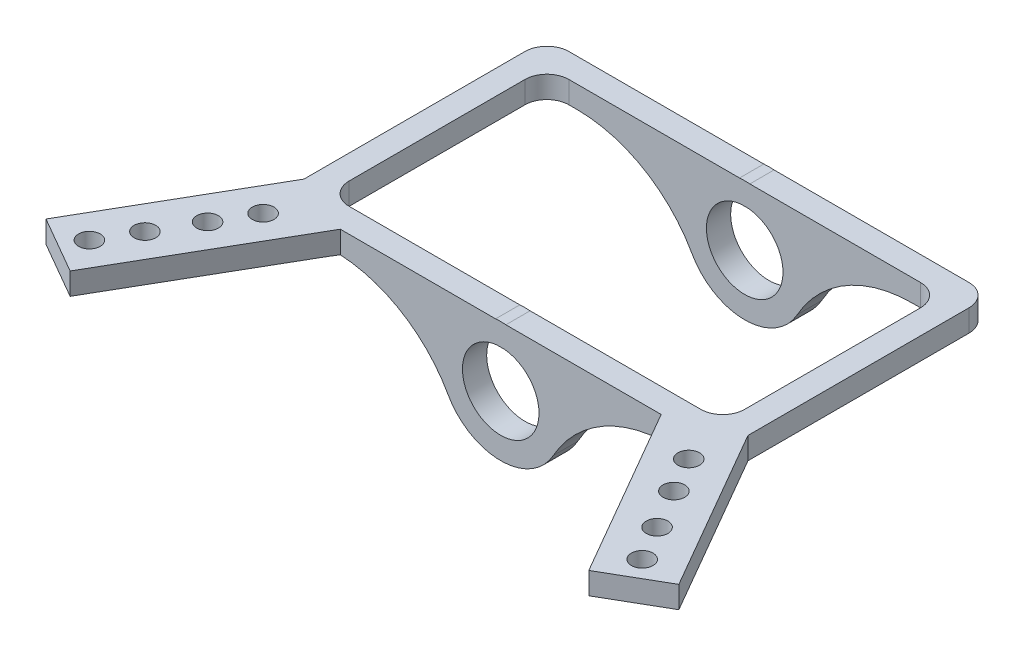
from build123d import *

# Parameters (mm, degrees)
SKETCH2_W               = 114.3
SKETCH2_H               = 63.5
BOSS_EXTRUDE1_DEPTH     = 6.35
CUT_EXTRUDE1_REACH      = 114.674
SKETCH3_R               = 3.125
BOSS_EXTRUDE7_REACH     = 158.854
SKETCH5_R               = 17.4135
SKETCH5_R_2             = 11.0635
FILLET1_R               = 38.1
CUT_EXTRUDE2_DEPTH      = 118.744132595
CUT_EXTRUDE2_DEPTH_BACK = 118.744132595
SKETCH6_W               = 114.3
SKETCH6_H               = 63.5
FILLET2_R               = 6.35


with BuildPart() as part:
    # Sketch2 → Boss-Extrude1 (new body)
    with BuildSketch(Plane(origin=(0, 0, 0), x_dir=(1, 0, 0), z_dir=(0, 1, 0))):
        Polygon((-64.561316825, 62.034331754), (-64.561316825, -8.177280248), (-91.845008266, -55.434020042), (-75.347224324, -64.959020042), (-46.772224324, -15.465668216), (45.949590674, -15.465668216), (74.524590674, -64.959020042), (91.022374616, -55.434020042), (63.738683175, -8.177280248), (63.738683175, 62.034331754), align=None)
        with Locations((-0.411316825, 23.284331754)):
            Rectangle(SKETCH2_W, SKETCH2_H, mode=Mode.SUBTRACT)
    extrude(amount=BOSS_EXTRUDE1_DEPTH)

    # Sketch3 → Cut-Extrude1 (cut, up to next)
    with BuildSketch(Plane(origin=(0, 6.35, 0), x_dir=(1, 0, 0), z_dir=(0, 1, 0)), mode=Mode.PRIVATE) as cut_extrude1_sk1:
        with Locations(Location((-67.783616297, -32.808466651, 0), (0, 0, 270))):
            Circle(SKETCH3_R)
    cut_extrude1_tool1 = extrude(cut_extrude1_sk1.sketch, amount=-CUT_EXTRUDE1_REACH, mode=Mode.PRIVATE) & part.part
    # Sketch3 → Cut-Extrude1 (cut, up to next)
    with BuildSketch(Plane(origin=(0, 6.35, 0), x_dir=(1, 0, 0), z_dir=(0, 1, 0)), mode=Mode.PRIVATE) as cut_extrude1_sk2:
        with Locations(Location((-61.908616236, -22.632668051, 0), (0, 0, 270))):
            Circle(SKETCH3_R)
    cut_extrude1_tool2 = extrude(cut_extrude1_sk2.sketch, amount=-CUT_EXTRUDE1_REACH, mode=Mode.PRIVATE) & part.part
    # Sketch3 → Cut-Extrude1 (cut, up to next)
    with BuildSketch(Plane(origin=(0, 6.35, 0), x_dir=(1, 0, 0), z_dir=(0, 1, 0)), mode=Mode.PRIVATE) as cut_extrude1_sk3:
        with Locations(Location((-74.408616255, -44.283303179, 0), (0, 0, 270))):
            Circle(SKETCH3_R)
    cut_extrude1_tool3 = extrude(cut_extrude1_sk3.sketch, amount=-CUT_EXTRUDE1_REACH, mode=Mode.PRIVATE) & part.part
    # Sketch3 → Cut-Extrude1 (cut, up to next)
    with BuildSketch(Plane(origin=(0, 6.35, 0), x_dir=(1, 0, 0), z_dir=(0, 1, 0)), mode=Mode.PRIVATE) as cut_extrude1_sk4:
        with Locations(Location((-80.283616316, -54.459101779, 0), (0, 0, 270))):
            Circle(SKETCH3_R)
    cut_extrude1_tool4 = extrude(cut_extrude1_sk4.sketch, amount=-CUT_EXTRUDE1_REACH, mode=Mode.PRIVATE) & part.part
    # Sketch3 → Cut-Extrude1 (cut, up to next)
    with BuildSketch(Plane(origin=(0, 6.35, 0), x_dir=(1, 0, 0), z_dir=(0, 1, 0)), mode=Mode.PRIVATE) as cut_extrude1_sk5:
        with Locations(Location((79.460982666, -54.459101779, 0), (0, 0, 270))):
            Circle(SKETCH3_R)
    cut_extrude1_tool5 = extrude(cut_extrude1_sk5.sketch, amount=-CUT_EXTRUDE1_REACH, mode=Mode.PRIVATE) & part.part
    # Sketch3 → Cut-Extrude1 (cut, up to next)
    with BuildSketch(Plane(origin=(0, 6.35, 0), x_dir=(1, 0, 0), z_dir=(0, 1, 0)), mode=Mode.PRIVATE) as cut_extrude1_sk6:
        with Locations(Location((73.585982605, -44.283303179, 0), (0, 0, 270))):
            Circle(SKETCH3_R)
    cut_extrude1_tool6 = extrude(cut_extrude1_sk6.sketch, amount=-CUT_EXTRUDE1_REACH, mode=Mode.PRIVATE) & part.part
    # Sketch3 → Cut-Extrude1 (cut, up to next)
    with BuildSketch(Plane(origin=(0, 6.35, 0), x_dir=(1, 0, 0), z_dir=(0, 1, 0)), mode=Mode.PRIVATE) as cut_extrude1_sk7:
        with Locations(Location((61.085982586, -22.632668051, 0), (0, 0, 270))):
            Circle(SKETCH3_R)
    cut_extrude1_tool7 = extrude(cut_extrude1_sk7.sketch, amount=-CUT_EXTRUDE1_REACH, mode=Mode.PRIVATE) & part.part
    # Sketch3 → Cut-Extrude1 (cut, up to next)
    with BuildSketch(Plane(origin=(0, 6.35, 0), x_dir=(1, 0, 0), z_dir=(0, 1, 0)), mode=Mode.PRIVATE) as cut_extrude1_sk8:
        with Locations(Location((66.960982647, -32.808466651, 0), (0, 0, 270))):
            Circle(SKETCH3_R)
    cut_extrude1_tool8 = extrude(cut_extrude1_sk8.sketch, amount=-CUT_EXTRUDE1_REACH, mode=Mode.PRIVATE) & part.part
    add(cut_extrude1_tool1.solids().sort_by_distance((-67.783616, 6.35, 32.808467))[0], mode=Mode.SUBTRACT)
    add(cut_extrude1_tool2.solids().sort_by_distance((-61.908616, 6.35, 22.632668))[0], mode=Mode.SUBTRACT)
    add(cut_extrude1_tool3.solids().sort_by_distance((-74.408616, 6.35, 44.283303))[0], mode=Mode.SUBTRACT)
    add(cut_extrude1_tool4.solids().sort_by_distance((-80.283616, 6.35, 54.459102))[0], mode=Mode.SUBTRACT)
    add(cut_extrude1_tool5.solids().sort_by_distance((79.460983, 6.35, 54.459102))[0], mode=Mode.SUBTRACT)
    add(cut_extrude1_tool6.solids().sort_by_distance((73.585983, 6.35, 44.283303))[0], mode=Mode.SUBTRACT)
    add(cut_extrude1_tool7.solids().sort_by_distance((61.085983, 6.35, 22.632668))[0], mode=Mode.SUBTRACT)
    add(cut_extrude1_tool8.solids().sort_by_distance((66.960983, 6.35, 32.808467))[0], mode=Mode.SUBTRACT)

    # Boss-Extrude7: up to this face of the body (flat: up to its plane)
    boss_extrude7_end = Plane(part.part.faces().sort_by_distance((-0.411316825, 3.175, 15.465668216))[0])
    # Sketch5 → Boss-Extrude7 (add, up to the picked face)
    with BuildSketch(Plane(origin=(0, 0, -62.034331754), x_dir=(-1, 0, 0), z_dir=(0, 0, -1)), mode=Mode.PRIVATE) as boss_extrude7_sk1:
        with Locations(Location((0.411316825, -11, 0), (0, 0, 39.175198934))):
            Circle(SKETCH5_R)
        with Locations(Location((0.411316825, -11, 0), (0, 0, 83.858334426))):
            Circle(SKETCH5_R_2, mode=Mode.SUBTRACT)
    boss_extrude7_tool1 = split(extrude(boss_extrude7_sk1.sketch, amount=-BOSS_EXTRUDE7_REACH, mode=Mode.PRIVATE), bisect_by=boss_extrude7_end, keep=Keep.BOTH, mode=Mode.PRIVATE)
    add(boss_extrude7_tool1.solids().sort_by(Axis((12.706125, -21.688873, -62.034332), (0, 0, 1)))[0])

    # Fillet1
    # the kernel refuses this fillet: 38.1 mm, written as the material it adds along each edge
    with BuildSketch(Plane(origin=(-13.910575406, 0, -62.034331754), x_dir=(-0.0867632885558369, -0.9962289554911443, 0), z_dir=(0, 0, 1))) as fillet1_piece_1:
        with BuildLine():
            CenterArc((40.988707325, -31.512603208), FILLET1_R, 124.197770407, 60.77965812)
            Line((3.032384121, -34.818284502), (0, 0))
            ThreePointArc((0, 0), (9.787278443, -3.010751549), (19.574556886, 0))
        make_face()
    extrude(amount=7)
    with BuildSketch(Plane(origin=(-13.910575406, 0, -62.034331754), x_dir=(-0.0867632885558369, -0.9962289554911443, 0), z_dir=(0, 0, 1))) as fillet1_piece_2_section:
        with BuildLine():
            CenterArc((40.988707325, -31.512603208), FILLET1_R, 124.197770407, 60.77965812)
            Line((3.032384121, -34.818284502), (0, 0))
            ThreePointArc((0, 0), (9.787278443, -3.010751549), (19.574556886, 0))
        make_face()
    fillet1_piece_2 = extrude(amount=94.37520705, mode=Mode.PRIVATE)
    fillet1_piece_2 = split(fillet1_piece_2, bisect_by=Plane(origin=(-46.479711347, 0.329171961, 15.465668216), z_dir=(0, 0, -1)), keep=Keep.TOP, mode=Mode.PRIVATE)
    fillet1_piece_2 = split(fillet1_piece_2, bisect_by=Plane(origin=(-46.479711347, 0.329171961, 8.465668246), z_dir=(0, 0, 1)), keep=Keep.TOP, mode=Mode.PRIVATE)
    fillet1_piece_2 = split(fillet1_piece_2, bisect_by=Plane(origin=(-44.894051642, 0.329171961, 12.212577706), z_dir=(-0.8660254037844385, 0, -0.5000000000000003)), keep=Keep.TOP, mode=Mode.PRIVATE)
    add(fillet1_piece_2)
    with BuildSketch(Plane(origin=(-13.910575406, 0, -62.034331754), x_dir=(-0.0867632885558369, -0.9962289554911443, 0), z_dir=(0, 0, 1))) as fillet1_piece_3_section:
        with BuildLine():
            CenterArc((40.988707325, -31.512603208), FILLET1_R, 124.197770407, 60.77965812)
            Line((3.032384121, -34.818284502), (0, 0))
            ThreePointArc((0, 0), (9.787278443, -3.010751549), (19.574556886, 0))
        make_face()
    fillet1_piece_3 = extrude(amount=94.37520705, mode=Mode.PRIVATE)
    fillet1_piece_3 = split(fillet1_piece_3, bisect_by=Plane(origin=(-48.157624669, 0.376146064, 15.465668216), z_dir=(0, 0, 1)), keep=Keep.TOP, mode=Mode.PRIVATE)
    fillet1_piece_3 = split(fillet1_piece_3, bisect_by=Plane(origin=(-47.638099539, 0.376146064, 16.965408082), z_dir=(-0.8660254037844385, 0, -0.5000000000000003)), keep=Keep.TOP, mode=Mode.PRIVATE)
    add(fillet1_piece_3)
    with BuildSketch(Plane(origin=(-13.910575406, 0, -62.034331754), x_dir=(-0.0867632885558369, -0.9962289554911443, 0), z_dir=(0, 0, 1))) as fillet1_piece_4_section:
        with BuildLine():
            CenterArc((40.988707325, -31.512603208), FILLET1_R, 124.197770407, 60.77965812)
            Line((3.032384121, -34.818284502), (0, 0))
            ThreePointArc((0, 0), (9.787278443, -3.010751549), (19.574556886, 0))
        make_face()
    fillet1_piece_4 = extrude(amount=94.37520705, mode=Mode.PRIVATE)
    fillet1_piece_4 = split(fillet1_piece_4, bisect_by=Plane(origin=(-24.321436326, -4.363073993, 15.465668216), z_dir=(0, 0, -1)), keep=Keep.TOP, mode=Mode.PRIVATE)
    fillet1_piece_4 = split(fillet1_piece_4, bisect_by=Plane(origin=(-24.321436326, -4.363073993, 8.465668246), z_dir=(0, 0, 1)), keep=Keep.TOP, mode=Mode.PRIVATE)
    fillet1_piece_4 = split(fillet1_piece_4, bisect_by=Plane(origin=(-39.648984709, -4.363073993, 3.127855288), z_dir=(0.8660254037844385, 0, 0.5000000000000003)), keep=Keep.TOP, mode=Mode.PRIVATE)
    add(fillet1_piece_4)
    with BuildSketch(Plane(origin=(13.087941757, 0, 32.340875296), x_dir=(0.08676328855268206, -0.9962289554914191, 0), z_dir=(0, 0, -1))) as fillet1_piece_5_section:
        with BuildLine():
            CenterArc((40.988707325, -31.512603208), FILLET1_R, 124.197770407, 60.77965812)
            Line((3.032384121, -34.818284502), (0, 0))
            ThreePointArc((0, 0), (9.787278443, -3.010751549), (19.574556886, 0))
        make_face()
    fillet1_piece_5 = extrude(amount=94.37520705, mode=Mode.PRIVATE)
    fillet1_piece_5 = split(fillet1_piece_5, bisect_by=Plane(origin=(47.334991019, 0.376146064, 15.465668216), z_dir=(0, 0, 1)), keep=Keep.TOP, mode=Mode.PRIVATE)
    fillet1_piece_5 = split(fillet1_piece_5, bisect_by=Plane(origin=(46.81546589, 0.376146064, 16.965408082), z_dir=(0.8660254037844373, 0, -0.5000000000000024)), keep=Keep.TOP, mode=Mode.PRIVATE)
    add(fillet1_piece_5)
    with BuildSketch(Plane(origin=(13.087941757, 0, 32.340875296), x_dir=(0.08676328855268206, -0.9962289554914191, 0), z_dir=(0, 0, -1))) as fillet1_piece_6_section:
        with BuildLine():
            CenterArc((40.988707325, -31.512603208), FILLET1_R, 124.197770407, 60.77965812)
            Line((3.032384121, -34.818284502), (0, 0))
            ThreePointArc((0, 0), (9.787278443, -3.010751549), (19.574556886, 0))
        make_face()
    fillet1_piece_6 = extrude(amount=94.37520705, mode=Mode.PRIVATE)
    fillet1_piece_6 = split(fillet1_piece_6, bisect_by=Plane(origin=(23.498802677, -4.363073993, 15.465668216), z_dir=(0, 0, -1)), keep=Keep.TOP, mode=Mode.PRIVATE)
    fillet1_piece_6 = split(fillet1_piece_6, bisect_by=Plane(origin=(38.826351059, -4.363073993, 3.127855288), z_dir=(-0.8660254037844373, 0, 0.5000000000000024)), keep=Keep.TOP, mode=Mode.PRIVATE)
    fillet1_piece_6 = split(fillet1_piece_6, bisect_by=Plane(origin=(23.498802677, -4.363073993, 8.465668246), z_dir=(0, 0, 1)), keep=Keep.TOP, mode=Mode.PRIVATE)
    add(fillet1_piece_6)
    with BuildSketch(Plane(origin=(13.087941757, 0, 32.340875296), x_dir=(0.08676328855268206, -0.9962289554914191, 0), z_dir=(0, 0, -1))) as fillet1_piece_7_section:
        with BuildLine():
            CenterArc((40.988707325, -31.512603208), FILLET1_R, 124.197770407, 60.77965812)
            Line((3.032384121, -34.818284502), (0, 0))
            ThreePointArc((0, 0), (9.787278443, -3.010751549), (19.574556886, 0))
        make_face()
    fillet1_piece_7 = extrude(amount=94.37520705, mode=Mode.PRIVATE)
    fillet1_piece_7 = split(fillet1_piece_7, bisect_by=Plane(origin=(45.657077697, 0.329171961, 15.465668216), z_dir=(0, 0, -1)), keep=Keep.TOP, mode=Mode.PRIVATE)
    fillet1_piece_7 = split(fillet1_piece_7, bisect_by=Plane(origin=(44.071417993, 0.329171961, 12.212577706), z_dir=(0.8660254037844373, 0, -0.5000000000000024)), keep=Keep.TOP, mode=Mode.PRIVATE)
    fillet1_piece_7 = split(fillet1_piece_7, bisect_by=Plane(origin=(45.657077697, 0.329171961, 8.465668246), z_dir=(0, 0, 1)), keep=Keep.TOP, mode=Mode.PRIVATE)
    add(fillet1_piece_7)
    with BuildSketch(Plane(origin=(13.087941757, 0, -55.034331754), x_dir=(0.08676328855268206, -0.9962289554914191, 0), z_dir=(0, 0, -1))) as fillet1_piece_8:
        with BuildLine():
            CenterArc((40.988707325, -31.512603208), FILLET1_R, 124.197770407, 60.77965812)
            Line((3.032384121, -34.818284502), (0, 0))
            ThreePointArc((0, 0), (9.787278443, -3.010751549), (19.574556886, 0))
        make_face()
    extrude(amount=7)
    with BuildSketch(Plane(origin=(13.087941757, 0, 102.840875266), x_dir=(0.08676328855268206, -0.9962289554914191, 0), z_dir=(0, 0, -1))) as fillet1_piece_9_section:
        with BuildLine():
            CenterArc((40.988707325, -31.512603208), FILLET1_R, 124.197770407, 60.77965812)
            Line((3.032384121, -34.818284502), (0, 0))
            ThreePointArc((0, 0), (9.787278443, -3.010751549), (19.574556886, 0))
        make_face()
    fillet1_piece_9 = extrude(amount=94.37520702, mode=Mode.PRIVATE)
    fillet1_piece_9 = split(fillet1_piece_9, bisect_by=Plane(origin=(47.334991019, 0.376146064, 15.465668216), z_dir=(0, 0, 1)), keep=Keep.TOP, mode=Mode.PRIVATE)
    fillet1_piece_9 = split(fillet1_piece_9, bisect_by=Plane(origin=(46.81546589, 0.376146064, 16.965408082), z_dir=(0.8660254037844373, 0, -0.5000000000000024)), keep=Keep.TOP, mode=Mode.PRIVATE)
    add(fillet1_piece_9)
    with BuildSketch(Plane(origin=(13.087941757, 0, 15.465668216), x_dir=(0.08676328855268206, -0.9962289554914191, 0), z_dir=(0, 0, -1))) as fillet1_piece_10_section:
        with BuildLine():
            CenterArc((40.988707325, -31.512603208), FILLET1_R, 124.197770407, 60.77965812)
            Line((3.032384121, -34.818284502), (0, 0))
            ThreePointArc((0, 0), (9.787278443, -3.010751549), (19.574556886, 0))
        make_face()
    fillet1_piece_10 = extrude(amount=6.99999997, mode=Mode.PRIVATE)
    fillet1_piece_10 = split(fillet1_piece_10, bisect_by=Plane(origin=(38.826351059, -4.363073993, 3.127855288), z_dir=(-0.8660254037844373, 0, 0.5000000000000024)), keep=Keep.TOP, mode=Mode.PRIVATE)
    add(fillet1_piece_10)
    with BuildSketch(Plane(origin=(13.087941757, 0, 15.465668216), x_dir=(0.08676328855268206, -0.9962289554914191, 0), z_dir=(0, 0, -1))) as fillet1_piece_11_section:
        with BuildLine():
            CenterArc((40.988707325, -31.512603208), FILLET1_R, 124.197770407, 60.77965812)
            Line((3.032384121, -34.818284502), (0, 0))
            ThreePointArc((0, 0), (9.787278443, -3.010751549), (19.574556886, 0))
        make_face()
    fillet1_piece_11 = extrude(amount=6.99999997, mode=Mode.PRIVATE)
    fillet1_piece_11 = split(fillet1_piece_11, bisect_by=Plane(origin=(44.071417993, 0.329171961, 12.212577706), z_dir=(0.8660254037844373, 0, -0.5000000000000024)), keep=Keep.TOP, mode=Mode.PRIVATE)
    add(fillet1_piece_11)
    with BuildSketch(Plane(origin=(13.087941757, 0, 15.465668216), x_dir=(0.08676328855268206, -0.9962289554914191, 0), z_dir=(0, 0, -1))) as fillet1_piece_12_section:
        with BuildLine():
            CenterArc((40.988707325, -31.512603208), FILLET1_R, 124.197770407, 60.77965812)
            Line((3.032384121, -34.818284502), (0, 0))
            ThreePointArc((0, 0), (9.787278443, -3.010751549), (19.574556886, 0))
        make_face()
    fillet1_piece_12 = extrude(amount=94.37520702, mode=Mode.PRIVATE)
    fillet1_piece_12 = split(fillet1_piece_12, bisect_by=Plane(origin=(23.87513999, -4.28338064, -62.034331754), z_dir=(0, 0, 1)), keep=Keep.TOP, mode=Mode.PRIVATE)
    fillet1_piece_12 = split(fillet1_piece_12, bisect_by=Plane(origin=(23.87513999, -4.28338064, -55.034331754), z_dir=(0, 0, -1)), keep=Keep.TOP, mode=Mode.PRIVATE)
    add(fillet1_piece_12)
    with BuildSketch(Plane(origin=(-13.910575406, 0, -78.909538804), x_dir=(-0.08676328855268226, -0.9962289554914191, 0), z_dir=(0, 0, 1))) as fillet1_piece_13_section:
        with BuildLine():
            CenterArc((40.988707325, -31.512603208), FILLET1_R, 124.197770407, 60.77965812)
            Line((3.032384121, -34.818284502), (0, 0))
            ThreePointArc((0, 0), (9.787278443, -3.010751549), (19.574556886, 0))
        make_face()
    fillet1_piece_13 = extrude(amount=94.37520702, mode=Mode.PRIVATE)
    fillet1_piece_13 = split(fillet1_piece_13, bisect_by=Plane(origin=(-24.69777364, -4.28338064, -62.034331754), z_dir=(0, 0, 1)), keep=Keep.TOP, mode=Mode.PRIVATE)
    fillet1_piece_13 = split(fillet1_piece_13, bisect_by=Plane(origin=(-24.69777364, -4.28338064, -55.034331754), z_dir=(0, 0, -1)), keep=Keep.TOP, mode=Mode.PRIVATE)
    add(fillet1_piece_13)
    with BuildSketch(Plane(origin=(-13.910575406, 0, 8.465668246), x_dir=(-0.0867632885558369, -0.9962289554911443, 0), z_dir=(0, 0, 1))) as fillet1_piece_14_section:
        with BuildLine():
            CenterArc((40.988707325, -31.512603208), FILLET1_R, 124.197770407, 60.77965812)
            Line((3.032384121, -34.818284502), (0, 0))
            ThreePointArc((0, 0), (9.787278443, -3.010751549), (19.574556886, 0))
        make_face()
    fillet1_piece_14 = extrude(amount=6.99999997, mode=Mode.PRIVATE)
    fillet1_piece_14 = split(fillet1_piece_14, bisect_by=Plane(origin=(-44.894051642, 0.329171961, 12.212577706), z_dir=(-0.8660254037844385, 0, -0.5000000000000003)), keep=Keep.TOP, mode=Mode.PRIVATE)
    add(fillet1_piece_14)
    with BuildSketch(Plane(origin=(-13.910575406, 0, 8.465668246), x_dir=(-0.0867632885558369, -0.9962289554911443, 0), z_dir=(0, 0, 1))) as fillet1_piece_15_section:
        with BuildLine():
            CenterArc((40.988707325, -31.512603208), FILLET1_R, 124.197770407, 60.77965812)
            Line((3.032384121, -34.818284502), (0, 0))
            ThreePointArc((0, 0), (9.787278443, -3.010751549), (19.574556886, 0))
        make_face()
    fillet1_piece_15 = extrude(amount=94.37520702, mode=Mode.PRIVATE)
    fillet1_piece_15 = split(fillet1_piece_15, bisect_by=Plane(origin=(-48.157624669, 0.376146064, 15.465668216), z_dir=(0, 0, 1)), keep=Keep.TOP, mode=Mode.PRIVATE)
    fillet1_piece_15 = split(fillet1_piece_15, bisect_by=Plane(origin=(-47.638099539, 0.376146064, 16.965408082), z_dir=(-0.8660254037844385, 0, -0.5000000000000003)), keep=Keep.TOP, mode=Mode.PRIVATE)
    add(fillet1_piece_15)
    with BuildSketch(Plane(origin=(-13.910575406, 0, 8.465668246), x_dir=(-0.0867632885558369, -0.9962289554911443, 0), z_dir=(0, 0, 1))) as fillet1_piece_16_section:
        with BuildLine():
            CenterArc((40.988707325, -31.512603208), FILLET1_R, 124.197770407, 60.77965812)
            Line((3.032384121, -34.818284502), (0, 0))
            ThreePointArc((0, 0), (9.787278443, -3.010751549), (19.574556886, 0))
        make_face()
    fillet1_piece_16 = extrude(amount=6.99999997, mode=Mode.PRIVATE)
    fillet1_piece_16 = split(fillet1_piece_16, bisect_by=Plane(origin=(-39.648984709, -4.363073993, 3.127855288), z_dir=(0.8660254037844385, 0, 0.5000000000000003)), keep=Keep.TOP, mode=Mode.PRIVATE)
    add(fillet1_piece_16)

    # Sketch6 → Cut-Extrude2 (cut, two sides: drawn at the far end of the back side and taken through both)
    with BuildSketch(Plane(origin=(0, 6.35, 0), x_dir=(1, 0, 0), z_dir=(0, 1, 0)).offset(-CUT_EXTRUDE2_DEPTH_BACK)):
        with Locations((-0.411316825, 23.284331754)):
            Rectangle(SKETCH6_W, SKETCH6_H)
    extrude(amount=CUT_EXTRUDE2_DEPTH + CUT_EXTRUDE2_DEPTH_BACK, mode=Mode.SUBTRACT)

    # Fillet2
    fillet2_edges = [part.edges().sort_by_distance(p)[0] for p in [
        (-64.561316825, 3.175, -62.034331754),
        (63.738683175, 3.175, -62.034331754),
        (56.738683175, 3.175, -55.034331754),
        (-57.561316825, 3.175, -55.034331754),
        (-57.561316825, 3.175, 8.465668246),
        (56.738683175, 3.175, 8.465668246),
    ]]
    fillet(fillet2_edges, radius=FILLET2_R)


solid = part.part
